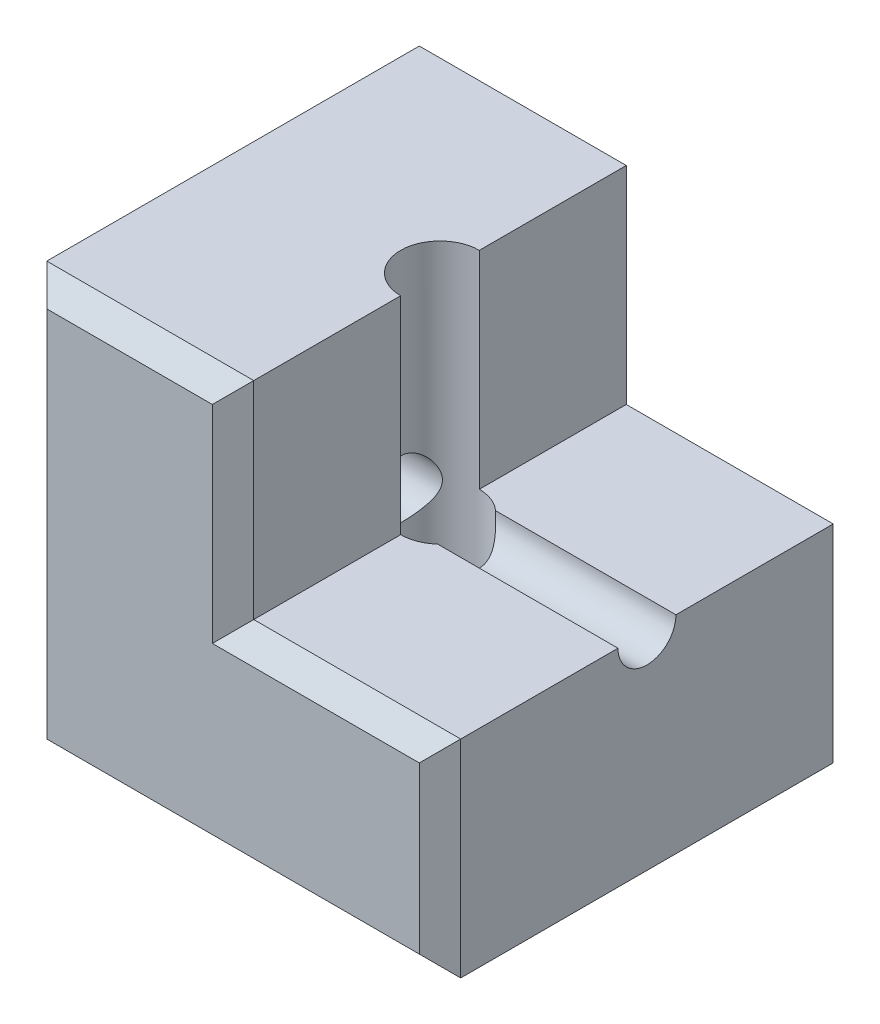
from build123d import *

# Parameters (mm, degrees)
BOSS_EXTRUDE2_DEPTH     = 20
SKETCH3_R               = 1.4
CUT_EXTRUDE1_DEPTH      = 35.641016151
CUT_EXTRUDE2_DEPTH      = 34
CUT_EXTRUDE2_DEPTH_BACK = 34
SKETCH4_R               = 1.9
CUT_EXTRUDE3_DEPTH      = 3
CHAMFER1_SIZE           = 1
CHAMFER2_SIZE           = 1
CHAMFER5_SIZE           = 1


with BuildPart() as part:
    # Sketch2 → Boss-Extrude2 (new body)
    with BuildSketch(Plane.XY):
        Polygon((0, 20), (0, 0), (20, 0), (20, 10), (10, 10), (10, 20), align=None)
    extrude(amount=BOSS_EXTRUDE2_DEPTH)

    # Sketch3 → Cut-Extrude1 (cut, through all)
    with BuildSketch(Plane.ZY):
        with Locations((10, 10)):
            Circle(SKETCH3_R)
    extrude(amount=-CUT_EXTRUDE1_DEPTH, mode=Mode.SUBTRACT)

    # Sketch4 → Cut-Extrude2 (cut, two sides: drawn at the far end of the back side and taken through both)
    with BuildSketch(Plane(origin=(0, 3, 0), x_dir=(-1, 0, 0), z_dir=(0, -1, 0)).offset(-CUT_EXTRUDE2_DEPTH_BACK)):
        with Locations((-10, -10)):
            Circle(SKETCH4_R)
    extrude(amount=CUT_EXTRUDE2_DEPTH + CUT_EXTRUDE2_DEPTH_BACK, mode=Mode.SUBTRACT)

    # Sketch5 → Cut-Extrude3 (cut)
    with BuildSketch(Plane(origin=(0, 3, 0), x_dir=(-1, 0, 0), z_dir=(0, -1, 0))):
        Polygon((-12.75, -5.5), (-14.223720558, 0), (-5.776279442, 0), (-7.25, -5.5), (-7.25, -14.5), (-12.75, -14.5), align=None)
    extrude(amount=-CUT_EXTRUDE3_DEPTH, mode=Mode.SUBTRACT)

    # Chamfer1
    chamfer1_edges = [part.edges().sort_by_distance(p)[0] for p in [
        (10, 3, 0),
        (10, 6, 0),
    ]]
    chamfer(chamfer1_edges, length=CHAMFER1_SIZE)

    # Chamfer2
    chamfer2_edges = [part.edges().sort_by_distance(p)[0] for p in [
        (10, 15, 20),
        (15, 10, 20),
        (20, 5, 20),
        (10, 0, 20),
        (0, 10, 20),
        (5, 20, 20),
    ]]
    chamfer(chamfer2_edges, length=CHAMFER2_SIZE)

    # Chamfer5
    chamfer5_edges = [part.edges().sort_by_distance(p)[0] for p in [
        (20, 5, 0),
        (10, 0, 0),
        (0, 10, 0),
        (5, 20, 0),
        (10, 15, 0),
        (15, 10, 0),
    ]]
    chamfer(chamfer5_edges, length=CHAMFER5_SIZE)


solid = part.part
